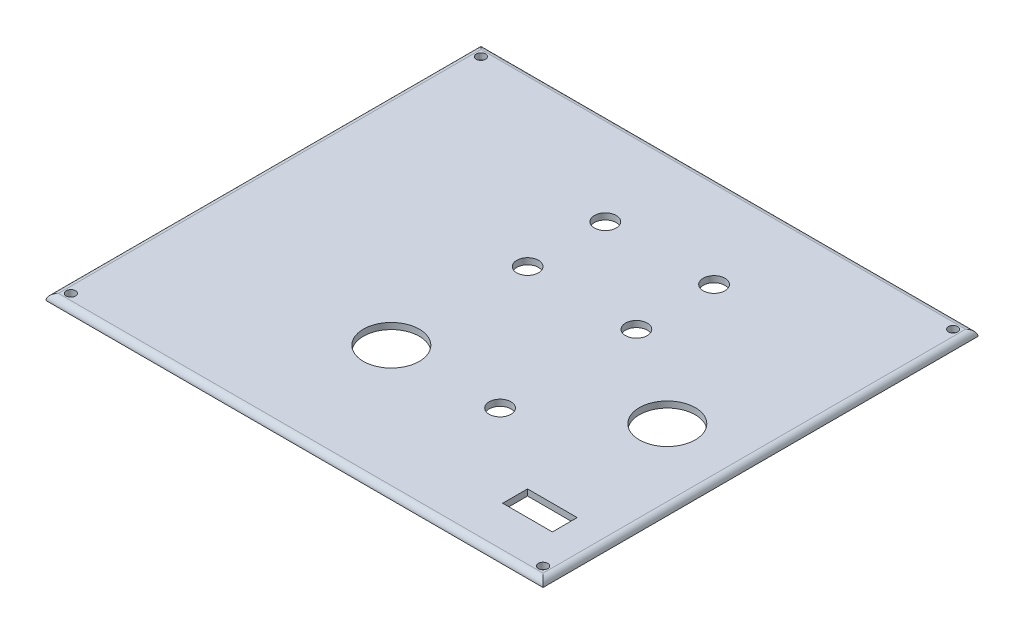
from build123d import *

# Parameters (mm, degrees)
SKETCH1_W             = 160
SKETCH1_H             = 140
BOSS_EXTRUDE1_DEPTH   = 2
F_3_0MM_DOWEL_HOLE1_D = 3
F_1_5MM_DOWEL_HOLE4_D = 18
F_3_0MM_DOWEL_HOLE2_D = 7
FILLET2_R             = 2
SKETCH22_W            = 16
SKETCH22_H            = 8
CUT_EXTRUDE1_DEPTH    = 2


with BuildPart() as part:
    # Sketch1 → Boss-Extrude1 (new body)
    with BuildSketch(Plane(origin=(0, 0, 0), x_dir=(1, 0, 0), z_dir=(0, 1, 0))):
        Rectangle(SKETCH1_W, SKETCH1_H)
    extrude(amount=BOSS_EXTRUDE1_DEPTH)

    # Ø3.0mm Dowel Hole1 (through all)
    with Locations(Plane(origin=(0, 2, 0), x_dir=(1, 0, 0), z_dir=(0, 1, 0))):
        with Locations((-76, 66), (76, 66), (76, -66), (-76, -66)):
            Hole(F_3_0MM_DOWEL_HOLE1_D / 2)

    # Ø1.5mm Dowel Hole4 (through all)
    with Locations(Plane(origin=(0, 2, 0), x_dir=(1, 0, 0), z_dir=(0, 1, 0))):
        with Locations((56.336, -6.348), (-9.958, -28.878)):
            Hole(F_1_5MM_DOWEL_HOLE4_D / 2)

    # Ø3.0mm Dowel Hole2 (through all)
    with Locations(Plane(origin=(0, 2, 0), x_dir=(1, 0, 0), z_dir=(0, 1, 0))):
        with Locations((-9.958, 40), (25.042, 40), (-9.958, 15), (25.042, 15), (25.042, -28.878)):
            Hole(F_3_0MM_DOWEL_HOLE2_D / 2)

    # Fillet2
    fillet2_edges = [part.edges().sort_by_distance(p)[0] for p in [
        (80, 2, 0),
        (0, 2, -70),
        (-80, 2, 0),
        (0, 2, 70),
    ]]
    fillet(fillet2_edges, radius=FILLET2_R - 0.0001)  # a hair under: the kernel refuses the full size

    # Sketch22 → Cut-Extrude1 (cut)
    with BuildSketch(Plane(origin=(0, 2, 0), x_dir=(1, 0, 0), z_dir=(0, 1, 0))):
        with Locations((60, -51)):
            Rectangle(SKETCH22_W, SKETCH22_H)
    extrude(amount=-CUT_EXTRUDE1_DEPTH, mode=Mode.SUBTRACT)


solid = part.part
